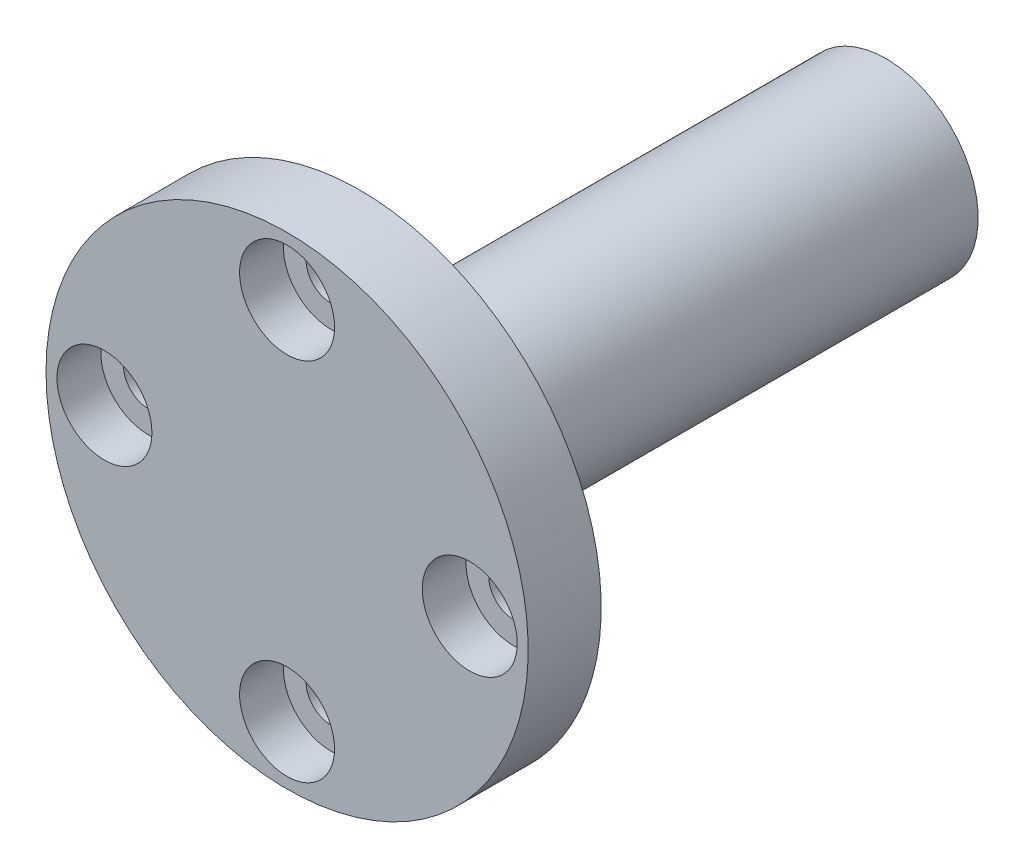
from build123d import *

# Parameters (mm, degrees)
HOLE_WIZARD_M31_D           = 3.4
HOLE_WIZARD_M31_CBORE_D     = 6.5
HOLE_WIZARD_M31_CBORE_DEPTH = 3


with BuildPart() as part:
    # Эскиз2 → Повернуть1 (revolve)
    with BuildSketch(Plane(origin=(0, 0, 0), x_dir=(0, 0, -1), z_dir=(1, 0, 0))):
        Polygon((0, 0), (0, 16.5), (5, 16.5), (5, 6.3), (41, 6.3), (41, 0), align=None)
    revolve(axis=Axis((0, 0, -41), (0, 0, 1)))

    # Цековка для винта с внутренним шестигранником M31 (through all)
    with Locations(Plane.XY):
        with Locations((-12.5, 0), (0, 12.5), (12.5, 0), (0, -12.5)):
            CounterBoreHole(HOLE_WIZARD_M31_D / 2, HOLE_WIZARD_M31_CBORE_D / 2, HOLE_WIZARD_M31_CBORE_DEPTH)


solid = part.part
